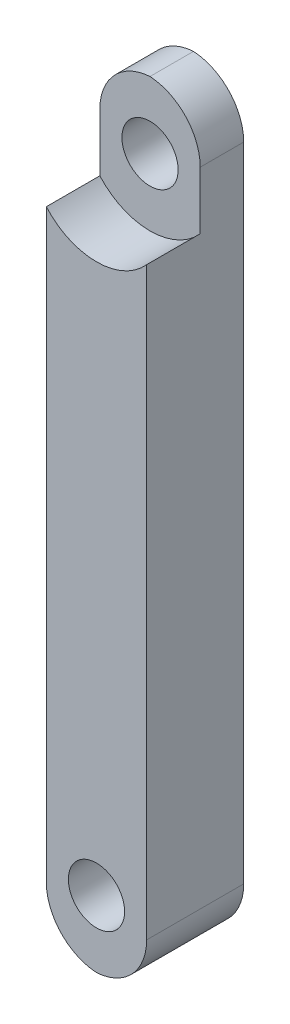
from build123d import *

# Parameters (mm, degrees)
SKETCH1_W           = 9.525
SKETCH1_H           = 71.12
SKETCH1_R           = 2.667
BOSS_EXTRUDE1_DEPTH = 9.2075
FILLET1_R           = 5.08
SKETCH2_R           = 6.35
CUT_EXTRUDE1_DEPTH  = 5.08


with BuildPart() as part:
    # Sketch1 → Boss-Extrude1 (new body)
    with BuildSketch(Plane.XY):
        Rectangle(SKETCH1_W, SKETCH1_H)
        with Locations((0, -29.21)):
            Circle(SKETCH1_R, mode=Mode.SUBTRACT)
        with Locations((0, 29.21)):
            Circle(SKETCH1_R, mode=Mode.SUBTRACT)
    extrude(amount=BOSS_EXTRUDE1_DEPTH)

    # Fillet1
    # the kernel refuses this fillet: 5.08 mm, written as the material it takes off along each edge
    with BuildSketch(Plane(origin=(-4.7625, -35.56, -12.7), x_dir=(1, 0, 0), z_dir=(0, 0, 1)), Plane(origin=(4.7625, -35.56, -12.7), x_dir=(0, 1, 0), z_dir=(0, 0, 1)), Plane(origin=(4.7625, 35.56, -12.7), x_dir=(-1, 0, 0), z_dir=(0, 0, 1))) as fillet1_piece_1:
        with BuildLine():
            CenterArc((FILLET1_R, FILLET1_R), FILLET1_R, 180, 90)
            Line((0, FILLET1_R), (0, 0))
            Line((0, 0), (FILLET1_R, 0))
        make_face()
    extrude(amount=34.6075, mode=Mode.SUBTRACT)
    with BuildSketch(Plane(origin=(-4.7625, 35.56, -12.7), x_dir=(1, 0, 0), z_dir=(0, 0, 1))) as fillet1_piece_2:
        with BuildLine():
            CenterArc((FILLET1_R, -FILLET1_R), FILLET1_R, 90, 90)
            Line((0, -FILLET1_R), (0, 0))
            Line((0, 0), (FILLET1_R, 0))
        make_face()
    extrude(amount=34.6075, mode=Mode.SUBTRACT)

    # Sketch2 → Cut-Extrude1 (cut)
    with BuildSketch(Plane.XY.offset(9.2075)):
        with Locations((0, 29.21)):
            Circle(SKETCH2_R)
    extrude(amount=-CUT_EXTRUDE1_DEPTH, mode=Mode.SUBTRACT)


solid = part.part
